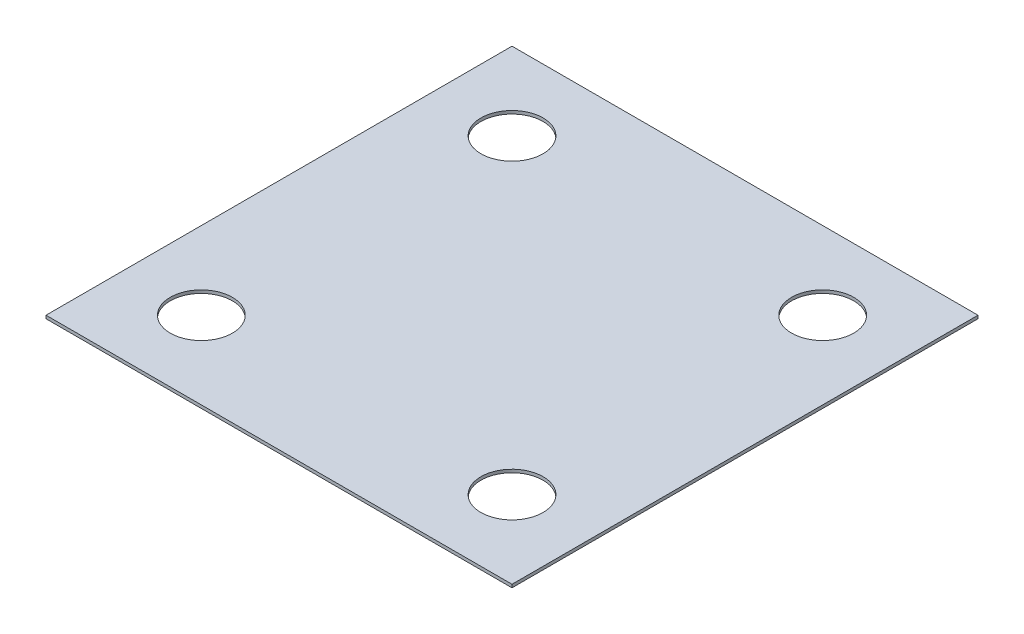
from build123d import *

# Parameters (mm, degrees)
SKETCH1_W          = 300
SKETCH1_H          = 300
BASE_FLANGE1_DEPTH = 2
SKETCH6_R          = 20
CUT_EXTRUDE1_DEPTH = 213.141462237


# Sheet-metal steps are written as plain solids
with BuildPart() as part:
    # Sketch1 → Base-Flange1 (new body)
    with BuildSketch(Plane(origin=(0, 0, 0), x_dir=(1, 0, 0), z_dir=(0, 1, 0))):
        Rectangle(SKETCH1_W, SKETCH1_H)
    extrude(amount=-BASE_FLANGE1_DEPTH)

    # Sketch6 → Cut-Extrude1 (cut, through all)
    with BuildSketch(Plane(origin=(0, 0, 0), x_dir=(1, 0, 0), z_dir=(0, 1, 0))):
        with Locations(Location((100, 100, 0), (0, 0, 270))):
            Circle(SKETCH6_R)
        with Locations(Location((100, -100, 0), (0, 0, 90))):
            Circle(SKETCH6_R)
        with Locations(Location((-100, -100, 0), (0, 0, 270))):
            Circle(SKETCH6_R)
        with Locations(Location((-100, 100, 0), (0, 0, 90))):
            Circle(SKETCH6_R)
    extrude(amount=-CUT_EXTRUDE1_DEPTH, mode=Mode.SUBTRACT)


solid = part.part
